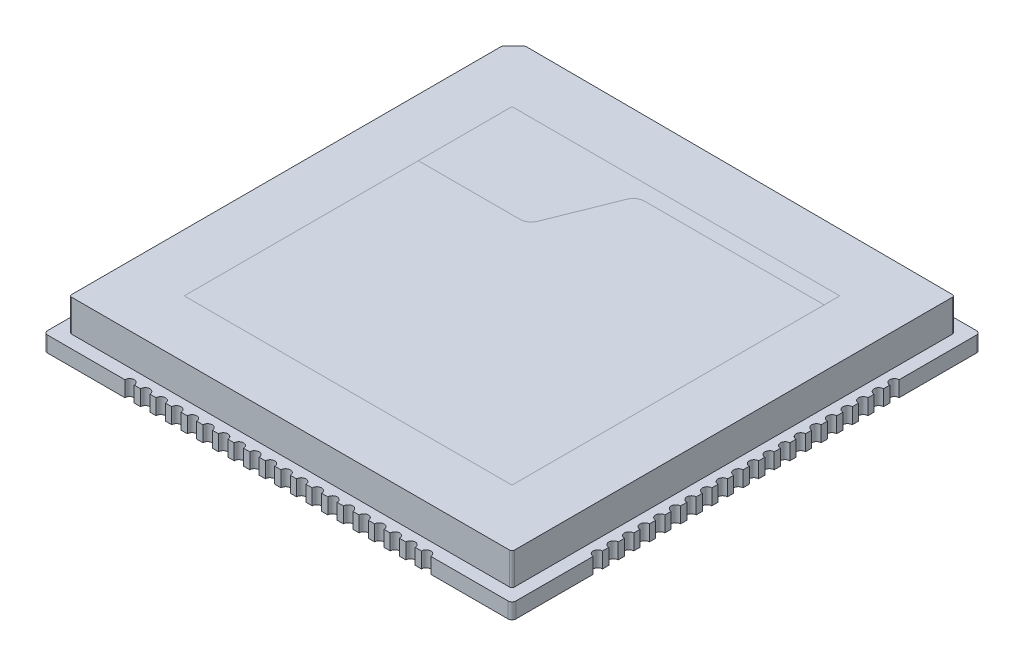
from build123d import *

# Parameters (mm, degrees)
SKETCH_4_W                  = 30
SKETCH_4_H                  = 30
EXTRUDE_2_DEPTH             = 1
FILLET_3_R                  = 0.25
SKETCH_18_R                 = 0.3
CUT_EXTRUDE_1_DEPTH         = 22.236760582
PATTERN_LINEAR_2_COUNT      = 20
PATTERN_LINEAR_2_PITCH      = 1
PATTERN_LINEAR_2_COUNT_DIR2 = 2
PATTERN_LINEAR_2_PITCH_DIR2 = 30
SKETCH_21_R                 = 0.3
CUT_EXTRUDE_2_DEPTH         = 22.236760582
PATTERN_LINEAR_5_COUNT      = 20
PATTERN_LINEAR_5_PITCH      = 1
PATTERN_LINEAR_5_COUNT_DIR2 = 2
PATTERN_LINEAR_5_PITCH_DIR2 = 30
EXTRUDE_3_DEPTH             = 2.05
FILLET_4_R                  = 0.15


with BuildPart() as part:
    # Эскиз4 → Бобышка-Вытянуть2 (new body)
    with BuildSketch(Plane(origin=(0, 0, 0), x_dir=(1, 0, 0), z_dir=(0, 1, 0))):
        Rectangle(SKETCH_4_W, SKETCH_4_H)
    extrude(amount=EXTRUDE_2_DEPTH)

    # Скругление3
    fillet_3_edges = [part.edges().sort_by_distance(p)[0] for p in [
        (15, 0.5, -15),
        (15, 0.5, 15),
        (-15, 0.5, 15),
        (-15, 0.5, -15),
    ]]
    fillet(fillet_3_edges, radius=FILLET_3_R)

    # Эскиз18 → Вырез-Вытянуть1 (cut, through all)
    with BuildSketch(Plane(origin=(0, 1, 0), x_dir=(1, 0, 0), z_dir=(0, 1, 0))):
        with Locations((-9.5, 15)):
            Circle(SKETCH_18_R)
    cut_extrude_1 = extrude(amount=-CUT_EXTRUDE_1_DEPTH, mode=Mode.SUBTRACT)

    # Линейный массив2: Cut-Extrude 1 20 × 2
    with Locations(*[(i * PATTERN_LINEAR_2_PITCH, 0, j * PATTERN_LINEAR_2_PITCH_DIR2) for i in range(PATTERN_LINEAR_2_COUNT) for j in range(PATTERN_LINEAR_2_COUNT_DIR2) if (i, j) != (0, 0)]):
        add(cut_extrude_1, mode=Mode.SUBTRACT)

    # Эскиз21 → Вырез-Вытянуть2 (cut, through all)
    with BuildSketch(Plane(origin=(0, 1, 0), x_dir=(1, 0, 0), z_dir=(0, 1, 0))):
        with Locations((-15, -9.5)):
            Circle(SKETCH_21_R)
    cut_extrude_2 = extrude(amount=-CUT_EXTRUDE_2_DEPTH, mode=Mode.SUBTRACT)

    # Линейный массив5: Cut-Extrude 2 20 × 2
    with Locations(*[(j * PATTERN_LINEAR_5_PITCH_DIR2, 0, -i * PATTERN_LINEAR_5_PITCH) for i in range(PATTERN_LINEAR_5_COUNT) for j in range(PATTERN_LINEAR_5_COUNT_DIR2) if (i, j) != (0, 0)]):
        add(cut_extrude_2, mode=Mode.SUBTRACT)

    # Эскиз5 → Бобышка-Вытянуть3 (add)
    with BuildSketch(Plane(origin=(0, 1, 0), x_dir=(1, 0, 0), z_dir=(0, 1, 0))):
        Polygon((-14.18, -14.18), (-14.18, 13.535281765), (-13.43, 14.285281765), (14.18, 14.18), (14.18, -14.18), align=None)
    extrude(amount=EXTRUDE_3_DEPTH)

    # Скругление4
    fillet_4_edges = [part.edges().sort_by_distance(p)[0] for p in [
        (-14.18, 2.025, 14.18),
        (14.18, 2.025, 14.18),
        (14.18, 2.025, -14.18),
        (-14.18, 2.025, -13.535281765),
        (-13.43, 2.025, -14.285281765),
    ]]
    fillet(fillet_4_edges, radius=FILLET_4_R)


solid = part.part
